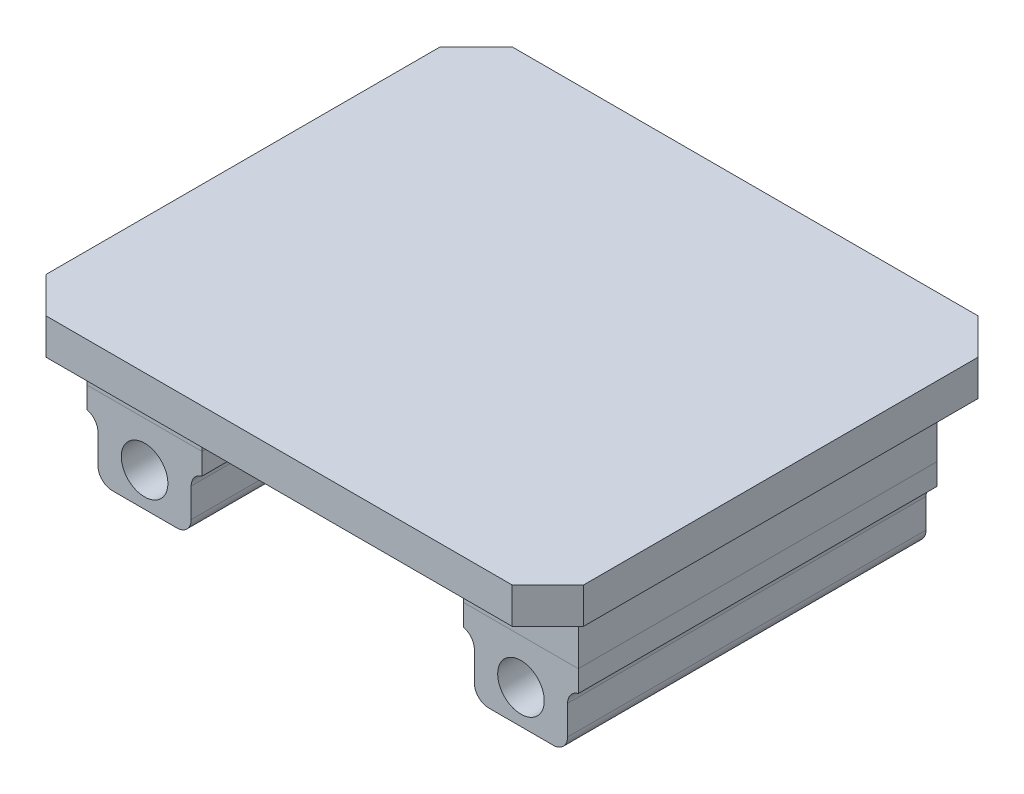
from build123d import *

# Parameters (mm, degrees)
SKETCH1_R           = 6.5
BOSS_EXTRUDE1_DEPTH = 50
SKETCH2_W           = 32
SKETCH2_H           = 100
BOSS_EXTRUDE2_DEPTH = 16
SKETCH5_W           = 150
SKETCH5_H           = 130
BOSS_EXTRUDE3_DEPTH = 10
CHAMFER1_SIZE       = 10
FILLET1_R           = 4
FILLET2_R           = 4


with BuildPart() as part:
    # Sketch1 → Boss-Extrude1 (new, symmetric)
    with BuildSketch(Plane.XY):
        Polygon((-39.5, -9.5), (-65.5, -9.5), (-65.5, 6.5), (-68.5, 6.5), (-68.5, 12.5), (-36.5, 12.5), (-36.5, 6.5), (-39.5, 6.5), align=None)
        with Locations((-52.5, 0)):
            Circle(SKETCH1_R, mode=Mode.SUBTRACT)
    extrude(amount=BOSS_EXTRUDE1_DEPTH, both=True)


with BuildPart() as body_2:
    # Sketch2 → Boss-Extrude2 (new body)
    with BuildSketch(Plane(origin=(0, 12.5, 0), x_dir=(1, 0, 0), z_dir=(0, 1, 0))):
        with Locations((-52.5, 0)):
            Rectangle(SKETCH2_W, SKETCH2_H)
    extrude(amount=BOSS_EXTRUDE2_DEPTH)


with BuildPart() as body_3:
    # Mirror5: mirrored copy
    add(body_2.part.mirror(Plane(origin=(0, 0, 0), x_dir=(0, 0, 1), z_dir=(1, 0, 0))))


with BuildPart() as body_4:
    # Mirror5 2: mirrored copy
    add(part.part.mirror(Plane(origin=(0, 0, 0), x_dir=(0, 0, 1), z_dir=(1, 0, 0))))

    # Fillet2
    # the kernel refuses this fillet: 4 mm, written as the material it adds along each edge
    with BuildSketch(Plane(origin=(65.5, 6.5, 50), x_dir=(1, 0, 0), z_dir=(0, 0, -1)), Plane(origin=(39.5, 6.5, -50), x_dir=(-1, 0, 0), z_dir=(0, 0, 1))) as fillet2_piece_1:
        with BuildLine():
            CenterArc((4, 3.872983346), FILLET2_R, 180, 75.522487814)
            Line((0, 3.872983346), (0, 0))
            Line((0, 0), (3, 0))
        make_face()
    extrude(amount=100)
    # the kernel refuses this fillet: 4 mm, written as the material it takes off along each edge
    with BuildSketch(Plane(origin=(65.5, -9.5, 60), x_dir=(-1, 0, 0), z_dir=(0, 0, -1)), Plane(origin=(39.5, -9.5, -60), x_dir=(1, 0, 0), z_dir=(0, 0, 1))) as fillet2_2_piece_1:
        with BuildLine():
            CenterArc((FILLET2_R, FILLET2_R), FILLET2_R, 180, 90)
            Line((0, FILLET2_R), (0, 0))
            Line((0, 0), (FILLET2_R, 0))
        make_face()
    extrude(amount=120, mode=Mode.SUBTRACT)


with BuildPart() as body_5:
    # Sketch5 → Boss-Extrude3 (new body)
    with BuildSketch(Plane(origin=(0, 28.5, 0), x_dir=(1, 0, 0), z_dir=(0, 1, 0))):
        Rectangle(SKETCH5_W, SKETCH5_H)
    extrude(amount=BOSS_EXTRUDE3_DEPTH)

    # Chamfer1
    chamfer1_edges = [body_5.edges().sort_by_distance(p)[0] for p in [
        (75, 33.5, 65),
        (-75, 33.5, 65),
        (-75, 33.5, -65),
        (75, 33.5, -65),
    ]]
    chamfer(chamfer1_edges, length=CHAMFER1_SIZE)


with BuildPart() as part_1:
    add(part.part)

    # Fillet1
    # the kernel refuses this fillet: 4 mm, written as the material it adds along each edge
    with BuildSketch(Plane(origin=(-39.5, 6.5, -50), x_dir=(1, 0, 0), z_dir=(0, 0, 1)), Plane(origin=(-65.5, 6.5, 50), x_dir=(-1, 0, 0), z_dir=(0, 0, -1))) as fillet1_piece_1:
        with BuildLine():
            CenterArc((4, -3.872983346), FILLET1_R, 104.477512186, 75.522487814)
            Line((0, -3.872983346), (0, 0))
            Line((0, 0), (3, 0))
        make_face()
    extrude(amount=100)
    # the kernel refuses this fillet: 4 mm, written as the material it takes off along each edge
    with BuildSketch(Plane(origin=(-39.5, -9.5, -60), x_dir=(-1, 0, 0), z_dir=(0, 0, 1)), Plane(origin=(-65.5, -9.5, 60), x_dir=(1, 0, 0), z_dir=(0, 0, -1))) as fillet1_2_piece_1:
        with BuildLine():
            CenterArc((FILLET1_R, -FILLET1_R), FILLET1_R, 90, 90)
            Line((0, -FILLET1_R), (0, 0))
            Line((0, 0), (FILLET1_R, 0))
        make_face()
    extrude(amount=120, mode=Mode.SUBTRACT)


solid = Compound([body_2.part, body_3.part, body_4.part, body_5.part, part_1.part])
